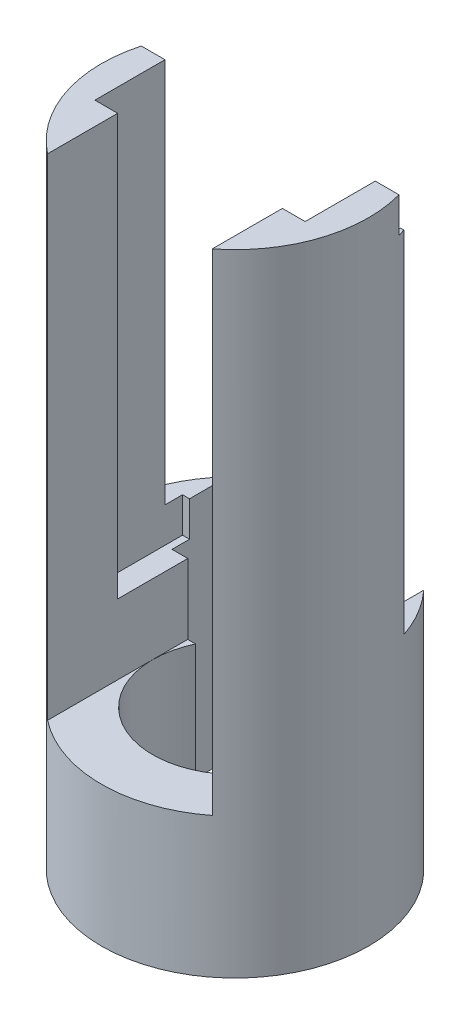
from build123d import *
from build123d.topology import SkipClean

# Parameters (mm, degrees)
SKETCH1_R            = 38.1
BOSS_EXTRUDE5_DEPTH  = 5
BOSS_EXTRUDE6_DEPTH  = 10
BOSS_EXTRUDE7_DEPTH  = 130
SKETCH6_W            = 60
SKETCH6_H            = 10
CUT_EXTRUDE1_DEPTH   = 20
SKETCH7_W            = 1.51134539
SKETCH7_H            = 120
BOSS_EXTRUDE8_DEPTH  = 2
SKETCH8_OUTSIDE_W    = 114.332
SKETCH8_OUTSIDE_H    = 114.332
SKETCH8_OUTSIDE_R    = 38.1
CUT_EXTRUDE2_DEPTH   = 155.687491414
SKETCH10_W           = 70.5
SKETCH10_H           = 2
BOSS_EXTRUDE9_DEPTH  = 20
SKETCH11_W           = 56
SKETCH11_H           = 30
CUT_EXTRUDE3_DEPTH   = 123.487632029
BOSS_EXTRUDE10_START = 35
BOSS_EXTRUDE10_DEPTH = 35
SKETCH13_R           = 23.5
CUT_EXTRUDE4_DEPTH   = 151.010732949
BOSS_EXTRUDE11_DEPTH = 20
SKETCH16_W           = 60
SKETCH16_H           = 25
CUT_EXTRUDE5_DEPTH   = 110


with BuildPart() as part:
    # Sketch1 → Boss-Extrude5 (new body)
    with BuildSketch(Plane(origin=(0, 0, 0), x_dir=(1, 0, 0), z_dir=(0, 1, 0))):
        with Locations(Location((0, 0, 0), (0, 0, 270))):
            Circle(SKETCH1_R)
    extrude(amount=BOSS_EXTRUDE5_DEPTH)

    # Sketch4 → Boss-Extrude6 (add)
    with BuildSketch(Plane(origin=(0, 5, 0), x_dir=(1, 0, 0), z_dir=(0, 1, 0))):
        with BuildLine():
            ThreePointArc((38.1, 0), (-16.677229986, 34.256094348), (-23.5, -29.989331436))
            Line((-23.5, -29.989331436), (-23.5, 10.010668564))
            Line((-23.5, 10.010668564), (23.5, 10.010668564))
            Line((23.5, 10.010668564), (23.5, -29.989331436))
            ThreePointArc((23.5, -29.989331436), (34.256094348, -16.677229986), (38.1, 0))
        make_face()
    extrude(amount=BOSS_EXTRUDE6_DEPTH)

    # Sketch5 → Boss-Extrude7 (add)
    with SkipClean():  # the faces are left unmerged after this step: merging them gives an invalid solid
        with BuildSketch(Plane(origin=(0, 15, 0), x_dir=(1, 0, 0), z_dir=(0, 1, 0))):
            with BuildLine():
                Line((-23.5, 10.010668564), (-36.76134539, 10.010668564))
                ThreePointArc((-36.76134539, 10.010668564), (-36.164311649, -11.98968569), (-23.5, -29.989331436))
                Line((-23.5, -29.989331436), (-23.5, 10.010668564))
            make_face()
            with BuildLine():
                Line((23.5, 10.010668564), (36.76134539, 10.010668564))
                ThreePointArc((36.76134539, 10.010668564), (36.164311649, -11.98968569), (23.5, -29.989331436))
                Line((23.5, -29.989331436), (23.5, 10.010668564))
            make_face()
        extrude(amount=BOSS_EXTRUDE7_DEPTH)

    # Sketch6 → Cut-Extrude1 (cut)
    with SkipClean():  # the faces are left unmerged after this step: merging them gives an invalid solid
        with BuildSketch(Plane(origin=(0, 0, -10.010668564), x_dir=(-1, 0, 0), z_dir=(0, 0, -1))):
            with Locations((0, 140)):
                Rectangle(SKETCH6_W, SKETCH6_H)
        extrude(amount=-CUT_EXTRUDE1_DEPTH, mode=Mode.SUBTRACT)

    # Sketch7 → Boss-Extrude8 (add)
    with SkipClean():  # the faces are left unmerged after this step: merging them gives an invalid solid
        with BuildSketch(Plane(origin=(0, 0, -10.010668564), x_dir=(-1, 0, 0), z_dir=(0, 0, -1))):
            with Locations((36.005672695, 75)):
                Rectangle(SKETCH7_W, SKETCH7_H)
            with Locations((-36.005672695, 75)):
                Rectangle(SKETCH7_W, SKETCH7_H)
        extrude(amount=BOSS_EXTRUDE8_DEPTH)

    # Sketch8 outside → Cut-Extrude2 (cut, through all)
    with SkipClean():  # the faces are left unmerged after this step: merging them gives an invalid solid
        with BuildSketch(Plane.XZ):
            Rectangle(SKETCH8_OUTSIDE_W, SKETCH8_OUTSIDE_H)
            with Locations(Location((0, 0, 0), (0, 0, 341.624658097))):
                Circle(SKETCH8_OUTSIDE_R, mode=Mode.SUBTRACT)
        extrude(amount=-CUT_EXTRUDE2_DEPTH, mode=Mode.SUBTRACT)
    add(part.part.scale(1), mode=Mode.REPLACE)  # the faces are merged on a copy

    # Sketch10 → Boss-Extrude9 (add)
    with SkipClean():  # the faces are left unmerged after this step: merging them gives an invalid solid
        with BuildSketch(Plane(origin=(0, 15, 0), x_dir=(1, 0, 0), z_dir=(0, 1, 0))):
            with Locations((0, 11.010668564)):
                Rectangle(SKETCH10_W, SKETCH10_H)
        extrude(amount=BOSS_EXTRUDE9_DEPTH)

    # Sketch11 → Cut-Extrude3 (cut, through all)
    with SkipClean():  # the faces are left unmerged after this step: merging them gives an invalid solid
        with BuildSketch(Plane(origin=(0, 35, 0), x_dir=(1, 0, 0), z_dir=(0, 1, 0))):
            with Locations((0, 25.010668564)):
                Rectangle(SKETCH11_W, SKETCH11_H)
        extrude(amount=-CUT_EXTRUDE3_DEPTH, mode=Mode.SUBTRACT)

    # Sketch12 → Boss-Extrude10 (add)
    with SkipClean():  # the faces are left unmerged after this step: merging them gives an invalid solid
        with BuildSketch(Plane.XZ.offset(BOSS_EXTRUDE10_START)):
            with BuildLine():
                Line((-28, -25.838150089), (-28, -10.010668564))
                Line((-28, -10.010668564), (28, -10.010668564))
                Line((28, -10.010668564), (28, -25.838150089))
                ThreePointArc((28, -25.838150089), (0, 38.1), (-28, -25.838150089))
            make_face()
        extrude(amount=-BOSS_EXTRUDE10_DEPTH)

    # Sketch13 → Cut-Extrude4 (cut, through all)
    with SkipClean():  # the faces are left unmerged after this step: merging them gives an invalid solid
        with BuildSketch(Plane(origin=(0, 5, 0), x_dir=(1, 0, 0), z_dir=(0, 1, 0))):
            Circle(SKETCH13_R)
        extrude(amount=-CUT_EXTRUDE4_DEPTH, mode=Mode.SUBTRACT)

    # Sketch14 → Boss-Extrude11 (add)
    with SkipClean():  # the faces are left unmerged after this step: merging them gives an invalid solid
        with BuildSketch(Plane(origin=(0, 15, 0), x_dir=(1, 0, 0), z_dir=(0, 1, 0))):
            with BuildLine():
                Line((28, 25.838150089), (28, 12.010668564))
                Line((28, 12.010668564), (36.157348363, 12.010668564))
                ThreePointArc((36.157348363, 12.010668564), (32.815257862, 19.35894758), (28, 25.838150089))
            make_face()
            with BuildLine():
                Line((-28, 12.010668564), (-28, 25.838150089))
                ThreePointArc((-28, 25.838150089), (-32.815257862, 19.35894758), (-36.157348363, 12.010668564))
                Line((-36.157348363, 12.010668564), (-28, 12.010668564))
            make_face()
        extrude(amount=BOSS_EXTRUDE11_DEPTH)

    # Sketch16 → Cut-Extrude5 (cut)
    with SkipClean():  # the faces are left unmerged after this step: merging them gives an invalid solid
        with BuildSketch(Plane(origin=(0, 135, 0), x_dir=(1, 0, 0), z_dir=(0, 1, 0))):
            with Locations((0, 2.510668564)):
                Rectangle(SKETCH16_W, SKETCH16_H)
        extrude(amount=-CUT_EXTRUDE5_DEPTH, mode=Mode.SUBTRACT)


solid = part.part
